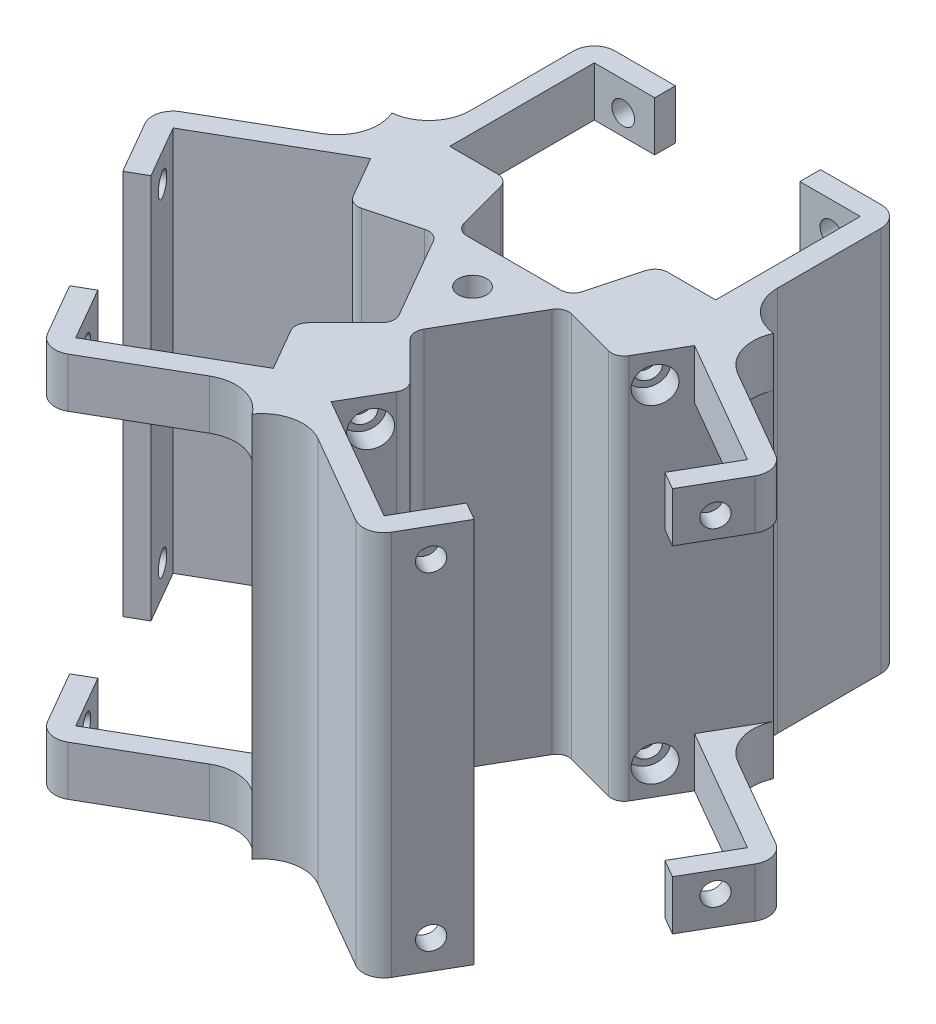
from build123d import *

# Parameters (mm, degrees)
SALIENTE_EXTRUIR1_DEPTH = 88.9
CROQUIS4_R              = 3.25
CORTAR_EXTRUIR1_DEPTH   = 112.44204772
REDONDEO6_R             = 3
REDONDEO7_R             = 3
ESCALA2_SCALE           = 1.05
SALIENTE_EXTRUIR2_DEPTH = 93.345
CROQUIS14_R             = 2.75
CORTAR_EXTRUIR2_DEPTH   = 10
CROQUIS15_R             = 4.25
CORTAR_EXTRUIR3_DEPTH   = 5.5
CROQUIS16_R             = 2.775
CORTAR_EXTRUIR4_DEPTH   = 3
MATRIZC7_COUNT          = 3
CROQUIS17_W             = 42
CROQUIS17_H             = 69.345
CORTAR_EXTRUIR5_DEPTH   = 31
CROQUIS18_W             = 45
CROQUIS18_H             = 69.345
CORTAR_EXTRUIR6_DEPTH   = 31
REDONDEO8_R             = 10
REDONDEO9_R             = 10
REDONDEO12_R            = 10
REDONDEO13_R            = 10
MATRIZC8_COUNT          = 3
REDONDEO14_R            = 10
REDONDEO16_R            = 10
REDONDEO17_R            = 3
CROQUIS20_R             = 2.78
CORTAR_EXTRUIR7_DEPTH   = 10
CROQUIS21_R             = 2.775
CORTAR_EXTRUIR8_DEPTH   = 10


with BuildPart() as part:
    # Croquis1 → Saliente-Extruir1 (new body)
    with BuildSketch(Plane(origin=(0, 0, 0), x_dir=(1, 0, 0), z_dir=(0, 1, 0))):
        Polygon((1.696358741, -16.064461222), (13.335, -27.703102481), (0, -50.8), (-13.335, -27.703102481), (-1.696358741, -16.064461222), (-14.760410887, 6.563140847), (-30.659090512, 2.303102481), (-43.994090512, 25.4), (-17.324090512, 25.4), (-13.064052146, 9.501320374), (13.064052146, 9.501320374), (17.324090512, 25.4), (43.994090512, 25.4), (30.659090512, 2.303102481), (14.760410887, 6.563140847), align=None)
    extrude(amount=SALIENTE_EXTRUIR1_DEPTH)

    # Croquis4 → Cortar-Extruir1 (cut, through all)
    with BuildSketch(Plane(origin=(0, 88.9, 0), x_dir=(1, 0, 0), z_dir=(0, 1, 0))):
        with Locations(Location((0, 0, 0), (0, 0, 270))):
            Circle(CROQUIS4_R)
    extrude(amount=-CORTAR_EXTRUIR1_DEPTH, mode=Mode.SUBTRACT)

    # Redondeo6
    redondeo6_edges = [part.edges().sort_by_distance(p)[0] for p in [
        (-1.696358741, 44.45, 16.064461222),
        (-14.760410887, 44.45, -6.563140847),
        (-13.064052146, 44.45, -9.501320374),
        (13.064052146, 44.45, -9.501320374),
        (1.696358741, 44.45, 16.064461222),
    ]]
    fillet(redondeo6_edges, radius=REDONDEO6_R)

    # Redondeo7
    redondeo7_edges = [part.edges().sort_by_distance(p)[0] for p in [
        (-13.335, 44.45, 27.703102481),
        (-30.659090512, 44.45, -2.303102481),
        (-17.324090512, 44.45, -25.4),
        (17.324090512, 44.45, -25.4),
        (30.659090512, 44.45, -2.303102481),
        (13.335, 44.45, 27.703102481),
    ]]
    fillet(redondeo7_edges, radius=REDONDEO7_R)


with BuildPart() as part_1:
    # Escala2: scaled about (-0.00814633, 44.45, 0.003262785)
    add(part.part.scale(ESCALA2_SCALE).moved(Location((0.000407317, -2.2225, -0.000163139))))

    # Croquis9 → Saliente-Extruir2 (add, through all)
    with BuildSketch(Plane(origin=(0, 91.1225, 0), x_dir=(1, 0, 0), z_dir=(0, 1, 0))):
        with BuildLine():
            Line((-37.193388788, 26.670163139), (-37.193388788, 61.670162712))
            ThreePointArc((-37.193388788, 61.670162712), (-35.728922694, 65.205696618), (-32.193388788, 66.670162712))
            Line((-32.193388788, 66.670162712), (-17.564301381, 66.670162712))
            Line((-17.564301381, 66.670162712), (-17.564301381, 61.670162712))
            Line((-17.564301381, 61.670162712), (-32.193388788, 61.670162712))
            Line((-32.193388788, 61.670162712), (-32.193388788, 26.670163139))
            Line((-32.193388788, 26.670163139), (-37.193388788, 26.670163139))
        make_face()
        with BuildLine():
            Line((-69.504104547, -2.954490104), (-39.193215784, 14.545509683))
            Line((-39.193215784, 14.545509683), (-41.693215784, 18.875636702))
            Line((-41.693215784, 18.875636702), (-72.004104547, 1.375636915))
            ThreePointArc((-72.004104547, 1.375636915), (-74.333733678, -1.660394878), (-73.834231566, -5.454490104))
            Line((-73.834231566, -5.454490104), (-66.519687862, -18.123651433))
            Line((-66.519687862, -18.123651433), (-62.189560843, -15.623651433))
            Line((-62.189560843, -15.623651433), (-69.504104547, -2.954490104))
        make_face()
        with BuildLine():
            Line((32.193388788, 61.670162712), (32.193388788, 26.670163139))
            Line((32.193388788, 26.670163139), (37.193388788, 26.670163139))
            Line((37.193388788, 26.670163139), (37.193388788, 61.670162712))
            ThreePointArc((37.193388788, 61.670162712), (35.728922694, 65.205696618), (32.193388788, 66.670162712))
            Line((32.193388788, 66.670162712), (17.564301381, 66.670162712))
            Line((17.564301381, 66.670162712), (17.564301381, 61.670162712))
            Line((17.564301381, 61.670162712), (32.193388788, 61.670162712))
        make_face()
        with BuildLine():
            Line((39.193733196, 14.545210955), (41.693733196, 18.875337974))
            Line((41.693733196, 18.875337974), (72.004621958, 1.375338188))
            ThreePointArc((72.004621958, 1.375338188), (74.33425109, -1.660693606), (73.834748977, -5.454788831))
            Line((73.834748977, -5.454788831), (66.520205273, -18.123950161))
            Line((66.520205273, -18.123950161), (62.190078254, -15.623950161))
            Line((62.190078254, -15.623950161), (69.504621958, -2.954788831))
            Line((69.504621958, -2.954788831), (39.193733196, 14.545210955))
        make_face()
        with BuildLine():
            Line((37.31123317, -58.715373881), (7.000344407, -41.215374094))
            Line((7.000344407, -41.215374094), (4.500344407, -45.545501113))
            Line((4.500344407, -45.545501113), (34.81123317, -63.0455009))
            ThreePointArc((34.81123317, -63.0455009), (38.605328395, -63.545003012), (41.641360189, -61.215373881))
            Line((41.641360189, -61.215373881), (48.955903893, -48.546212551))
            Line((48.955903893, -48.546212551), (44.625776874, -46.046212551))
            Line((44.625776874, -46.046212551), (37.31123317, -58.715373881))
        make_face()
        with BuildLine():
            Line((-6.999826996, -41.215075367), (-4.499826996, -45.545202386))
            Line((-4.499826996, -45.545202386), (-34.810715758, -63.045202172))
            ThreePointArc((-34.810715758, -63.045202172), (-38.604810984, -63.544704284), (-41.640842777, -61.215075153))
            Line((-41.640842777, -61.215075153), (-48.955386481, -48.545913824))
            Line((-48.955386481, -48.545913824), (-44.625259462, -46.045913824))
            Line((-44.625259462, -46.045913824), (-37.310715758, -58.715075153))
            Line((-37.310715758, -58.715075153), (-6.999826996, -41.215075367))
        make_face()
    extrude(amount=-SALIENTE_EXTRUIR2_DEPTH)

    # Croquis14 → Cortar-Extruir2 (cut)
    with BuildSketch(Plane(origin=(0, 0, -66.670162712), x_dir=(-1, 0, 0), z_dir=(0, 0, -1))):
        with Locations((25.193388788, 84.1225)):
            Circle(CROQUIS14_R)
        with Locations((25.193388788, 4.7775)):
            Circle(CROQUIS14_R)
        with Locations((-25.193388788, 4.7775)):
            Circle(CROQUIS14_R)
        with Locations((-25.193388788, 84.1225)):
            Circle(CROQUIS14_R)
    extrude(amount=-CORTAR_EXTRUIR2_DEPTH, mode=Mode.SUBTRACT)

    # Croquis15 → Cortar-Extruir3 (cut)
    with BuildSketch(Plane(origin=(0, 0, -26.670163139), x_dir=(-1, 0, 0), z_dir=(0, 0, -1))):
        with Locations((-25.193388788, 4.7775)):
            Circle(CROQUIS15_R)
        with Locations((25.193388788, 4.7775)):
            Circle(CROQUIS15_R)
        with Locations((-25.193388788, 84.1225)):
            Circle(CROQUIS15_R)
        with Locations((25.193388788, 84.1225)):
            Circle(CROQUIS15_R)
    cortar_extruir3 = extrude(amount=-CORTAR_EXTRUIR3_DEPTH, mode=Mode.SUBTRACT)

    # Croquis16 → Cortar-Extruir4 (cut)
    with BuildSketch(Plane(origin=(0, 0, -21.170163139), x_dir=(-1, 0, 0), z_dir=(0, 0, -1))):
        with Locations((-25.193388788, 4.7775)):
            Circle(CROQUIS16_R)
        with Locations((25.193388788, 4.7775)):
            Circle(CROQUIS16_R)
        with Locations((25.193388788, 84.1225)):
            Circle(CROQUIS16_R)
        with Locations((-25.193388788, 84.1225)):
            Circle(CROQUIS16_R)
    cortar_extruir4 = extrude(amount=-CORTAR_EXTRUIR4_DEPTH, mode=Mode.SUBTRACT)

    # MatrizC7: Cortar-Extruir3, Cortar-Extruir4 ×3 about axis
    matrizc7_axis = Axis((0.000407317, 0, -0.000163139), (0, 1, 0))
    add([cortar_extruir3.rotate(matrizc7_axis, i * 360 / MATRIZC7_COUNT) for i in range(1, MATRIZC7_COUNT)], mode=Mode.SUBTRACT)
    add([cortar_extruir4.rotate(matrizc7_axis, i * 360 / MATRIZC7_COUNT) for i in range(1, MATRIZC7_COUNT)], mode=Mode.SUBTRACT)

    # Croquis17 → Cortar-Extruir5 (cut)
    with BuildSketch(Plane(origin=(18.596694394, 0, -32.210419544), x_dir=(-0.8660254037844386, 0, -0.5000000000000001), z_dir=(0.5000000000000001, 0, -0.8660254037844386))):
        with Locations((-47.670271177, 44.45)):
            Rectangle(CROQUIS17_W, CROQUIS17_H)
    extrude(amount=-CORTAR_EXTRUIR5_DEPTH, mode=Mode.SUBTRACT)

    # Croquis18 → Cortar-Extruir6 (cut)
    with BuildSketch(Plane.ZY.offset(37.193388788)):
        with Locations((-49.170163139, 44.45)):
            Rectangle(CROQUIS18_W, CROQUIS18_H)
    cortar_extruir6 = extrude(amount=-CORTAR_EXTRUIR6_DEPTH, mode=Mode.SUBTRACT)

    # Redondeo8
    # the kernel refuses this fillet: 10 mm, written as the material it adds along each edge
    with BuildSketch(Plane(origin=(-37.193388788, 91.1225, -26.670163139), x_dir=(0, 0, -1), z_dir=(0, -1, 0))) as redondeo8_piece_1_section:
        with BuildLine():
            CenterArc((9.949874264, -10), REDONDEO8_R, 90, 84.260823378)
            Line((0, -8.999998933), (-0.198997485, -8.979998912))
            ThreePointArc((-0.198997485, -8.979998912), (-0.2, -4.499999466), (-0.2, 0))
            Line((-0.2, 0), (0, 0.2))
            Line((0, 0.2), (9.949874264, 0.2))
            Line((9.949874264, 0.2), (9.949874264, 0))
        make_face()
    redondeo8_piece_1 = extrude(amount=12, mode=Mode.PRIVATE)
    redondeo8_piece_1 = split(redondeo8_piece_1, bisect_by=Plane(origin=(-45.471806186, 85.1225, -25.420347259), z_dir=(0.8660254037844427, 0, -0.49999999999999306)), keep=Keep.TOP, mode=Mode.PRIVATE)
    add(redondeo8_piece_1)
    with BuildSketch(Plane(origin=(-37.193388788, 9.7775, -26.670163139), x_dir=(-1, 0, 0), z_dir=(0, -1, 0))) as redondeo8_piece_2_section:
        with BuildLine():
            CenterArc((10, 9.949874264), REDONDEO8_R, 180, 84.260823378)
            Line((0, 9.949874264), (-0.2, 9.949874264))
            Line((-0.2, 9.949874264), (-0.2, 0))
            Line((-0.2, 0), (0, -0.2))
            ThreePointArc((0, -0.2), (4.499999466, -0.2), (8.979998912, -0.198997485))
            Line((8.979998912, -0.198997485), (8.999998933, 0))
        make_face()
    redondeo8_piece_2 = extrude(amount=12, mode=Mode.PRIVATE)
    redondeo8_piece_2 = split(redondeo8_piece_2, bisect_by=Plane(origin=(-45.471806186, 3.7775, -25.420347259), z_dir=(0.8660254037844427, 0, -0.49999999999999306)), keep=Keep.TOP, mode=Mode.PRIVATE)
    add(redondeo8_piece_2)

    # Redondeo9
    # the kernel refuses this fillet: 10 mm, written as the material it adds along each edge
    with BuildSketch(Plane(origin=(37.193388788, 91.1225, -26.670163139), x_dir=(0, 0, -1), z_dir=(0, -1, 0))) as redondeo9_piece_1_section:
        with BuildLine():
            CenterArc((9.949956104, 10), REDONDEO9_R, 185.734485624, 84.265514376)
            Line((0, 9.000813566), (-0.198999122, 8.980829837))
            ThreePointArc((-0.198999122, 8.980829837), (-0.2, 4.500406783), (-0.2, 0))
            Line((-0.2, 0), (0, -0.2))
            Line((0, -0.2), (9.949956104, -0.2))
            Line((9.949956104, -0.2), (9.949956104, 0))
        make_face()
    redondeo9_piece_1 = extrude(amount=93.345, mode=Mode.PRIVATE)
    redondeo9_piece_1 = split(redondeo9_piece_1, bisect_by=Plane(origin=(45.472441412, 44.450000001, -25.420036516), z_dir=(-0.8660254037844312, 0, -0.5000000000000131)), keep=Keep.TOP, mode=Mode.PRIVATE)
    add(redondeo9_piece_1)

    # Redondeo12
    # the kernel refuses this fillet: 10 mm, written as the material it adds along each edge
    with BuildSketch(Plane(origin=(4.500437971, 91.1225, 45.545555132), x_dir=(0.8660254037844384, 0, 0.5000000000000003), z_dir=(0, -1, 0))) as redondeo12_piece_1_section:
        with BuildLine():
            CenterArc((9.949880533, 10), REDONDEO12_R, 185.738817437, 84.261182563)
            Line((0, 9.000061308), (-0.198997611, 8.980062535))
            ThreePointArc((-0.198997611, 8.980062535), (-0.2, 4.500030654), (-0.2, 0))
            Line((-0.2, 0), (0, -0.2))
            Line((0, -0.2), (9.949880533, -0.2))
            Line((9.949880533, -0.2), (9.949880533, 0))
        make_face()
    redondeo12_piece_1 = extrude(amount=93.345, mode=Mode.PRIVATE)
    redondeo12_piece_1 = split(redondeo12_piece_1, bisect_by=Plane(origin=(-0.721187955, 44.45, 52.089997188), z_dir=(0.8660254037844385, 0, -0.5000000000000004)), keep=Keep.TOP, mode=Mode.PRIVATE)
    add(redondeo12_piece_1)

    # Redondeo13
    # the kernel refuses this fillet: 10 mm, written as the material it adds along each edge
    with BuildSketch(Plane(origin=(41.693826759, 91.1225, -18.875283955), x_dir=(0.500000000000013, 0, -0.8660254037844312), z_dir=(0, -1, 0))) as redondeo13_piece_1_section:
        with BuildLine():
            CenterArc((10, 9.94994984), REDONDEO13_R, 180, 84.265155193)
            Line((0, 9.94994984), (-0.2, 9.94994984))
            Line((-0.2, 9.94994984), (-0.2, 0))
            Line((-0.2, 0), (0, -0.2))
            ThreePointArc((0, -0.2), (4.500375595, -0.2), (8.980766214, -0.198998997))
            Line((8.980766214, -0.198998997), (9.00075119, 0))
        make_face()
    redondeo13_piece_1 = extrude(amount=12, mode=Mode.PRIVATE)
    redondeo13_piece_1 = redondeo13_piece_1 - Plane(origin=(47.193388788, 85.1225, -36.620119243), x_dir=(0, 0, -1), z_dir=(0, 1, 0)) * Cylinder(10, 64, mode=Mode.PRIVATE)
    add(redondeo13_piece_1)
    with BuildSketch(Plane(origin=(41.693826759, 9.7775, -18.875283955), x_dir=(0.8660254037844392, 0, 0.4999999999999991), z_dir=(0, -1, 0))) as redondeo13_piece_2_section:
        with BuildLine():
            CenterArc((9.94994984, -10), REDONDEO13_R, 90, 84.265155193)
            Line((0, -9.00075119), (-0.198998997, -8.980766214))
            ThreePointArc((-0.198998997, -8.980766214), (-0.2, -4.500375595), (-0.2, 0))
            Line((-0.2, 0), (0, 0.2))
            Line((0, 0.2), (9.94994984, 0.2))
            Line((9.94994984, 0.2), (9.94994984, 0))
        make_face()
    redondeo13_piece_2 = extrude(amount=12, mode=Mode.PRIVATE)
    redondeo13_piece_2 = redondeo13_piece_2 - Plane(origin=(47.193388788, 3.7775, -36.620119243), x_dir=(0, 0, -1), z_dir=(0, 1, 0)) * Cylinder(10, 64, mode=Mode.PRIVATE)
    add(redondeo13_piece_2)

    # MatrizC8: Cortar-Extruir6 ×3 about axis
    matrizc8_axis = Axis((0.000407317, 91.1225, -0.000163139), (0, 1, 0))
    for i in range(1, MATRIZC8_COUNT):
        add(cortar_extruir6.rotate(matrizc8_axis, i * 360 / MATRIZC8_COUNT), mode=Mode.SUBTRACT)

    # Redondeo14
    # the kernel refuses this fillet: 10 mm, written as the material it adds along each edge
    with BuildSketch(Plane(origin=(-4.499826996, 9.7775, 45.545202386), x_dir=(0.4999999999984365, 0, 0.8660254037853413), z_dir=(0, -1, 0))) as redondeo14_piece_1_section:
        with BuildLine():
            CenterArc((10, 9.949921458), REDONDEO14_R, 180, 84.263528066)
            Line((0, 9.949921459), (-0.2, 9.949921459))
            Line((-0.2, 9.949921459), (-0.2, 0))
            Line((-0.2, 0), (0, -0.2))
            ThreePointArc((0, -0.2), (4.500234312, -0.2), (8.980477997, -0.198998429))
            Line((8.980477997, -0.198998429), (9.000468625, 0))
        make_face()
    redondeo14_piece_1 = extrude(amount=12, mode=Mode.PRIVATE)
    redondeo14_piece_1 = redondeo14_piece_1 - Plane(origin=(8.117287277, 3.777500001, 59.180749436), x_dir=(0.866025403784329, 0, 0.50000000000019), z_dir=(0, 1, 0)) * Cylinder(10, 64, mode=Mode.PRIVATE)
    add(redondeo14_piece_1)
    with BuildSketch(Plane(origin=(-4.499826996, 91.1225, 45.545202386), x_dir=(0.4999999999984365, 0, 0.8660254037853413), z_dir=(0, -1, 0))) as redondeo14_piece_2_section:
        with BuildLine():
            CenterArc((10, 9.949921458), REDONDEO14_R, 180, 84.263528066)
            Line((0, 9.949921459), (-0.2, 9.949921459))
            Line((-0.2, 9.949921459), (-0.2, 0))
            Line((-0.2, 0), (0, -0.2))
            ThreePointArc((0, -0.2), (4.500234312, -0.2), (8.980477997, -0.198998429))
            Line((8.980477997, -0.198998429), (9.000468625, 0))
        make_face()
    redondeo14_piece_2 = extrude(amount=12, mode=Mode.PRIVATE)
    redondeo14_piece_2 = redondeo14_piece_2 - Plane(origin=(8.117287277, 85.1225, 59.180749436), x_dir=(0.866025403784329, 0, 0.50000000000019), z_dir=(0, 1, 0)) * Cylinder(10, 64, mode=Mode.PRIVATE)
    add(redondeo14_piece_2)

    # Redondeo16
    # the kernel refuses this fillet: 10 mm, written as the material it adds along each edge
    with BuildSketch(Plane(origin=(-41.693215784, 91.1225, -18.875636702), x_dir=(-0.8660254037844388, 0, 0.4999999999999999), z_dir=(0, -1, 0))) as redondeo16_piece_1_section:
        with BuildLine():
            CenterArc((9.949908926, 10), REDONDEO16_R, 185.737190303, 84.262809697)
            Line((0, 9.000343874), (-0.198998178, 8.980350751))
            ThreePointArc((-0.198998178, 8.980350751), (-0.2, 4.500171937), (-0.2, 0))
            Line((-0.2, 0), (0, -0.2))
            Line((0, -0.2), (9.949908926, -0.2))
            Line((9.949908926, -0.2), (9.949908926, 0))
        make_face()
    redondeo16_piece_1 = extrude(amount=93.345, mode=Mode.PRIVATE)
    redondeo16_piece_1 = split(redondeo16_piece_1, bisect_by=Plane(origin=(-44.750072721, 44.45, -26.670163139), z_dir=(0, 0, 1)), keep=Keep.TOP, mode=Mode.PRIVATE)
    add(redondeo16_piece_1)

    # Redondeo17
    redondeo17_edges = [part_1.edges().sort_by_distance(p)[0] for p in [
        (15.498838747, 44.45, -6.891461029),
    ]]
    fillet(redondeo17_edges, radius=REDONDEO17_R)

    # Croquis20 → Cortar-Extruir7 (cut)
    with BuildSketch(Plane(origin=(-57.737537171, 0, 33.334782628), x_dir=(0.5000000000000017, 0, 0.8660254037844378), z_dir=(-0.8660254037844377, 0, 0.5000000000000016))):
        with Locations((25.193388788, 4.7775)):
            Circle(CROQUIS20_R)
        with Locations((25.193388788, 84.1225)):
            Circle(CROQUIS20_R)
        with Locations((-25.193388788, 84.1225)):
            Circle(CROQUIS20_R)
        with Locations((-25.193388788, 4.7775)):
            Circle(CROQUIS20_R)
    extrude(amount=-CORTAR_EXTRUIR7_DEPTH, mode=Mode.SUBTRACT)

    # Croquis21 → Cortar-Extruir8 (cut)
    with BuildSketch(Plane(origin=(57.738054583, 0, 33.335081356), x_dir=(0.4999999999999987, 0, -0.8660254037844395), z_dir=(0.8660254037844395, 0, 0.4999999999999987))):
        with Locations((25.193388788, 4.7775)):
            Circle(CROQUIS21_R)
        with Locations((25.193388788, 84.1225)):
            Circle(CROQUIS21_R)
        with Locations((-25.193388788, 84.1225)):
            Circle(CROQUIS21_R)
        with Locations((-25.193388788, 4.7775)):
            Circle(CROQUIS21_R)
    extrude(amount=-CORTAR_EXTRUIR8_DEPTH, mode=Mode.SUBTRACT)


solid = part_1.part
